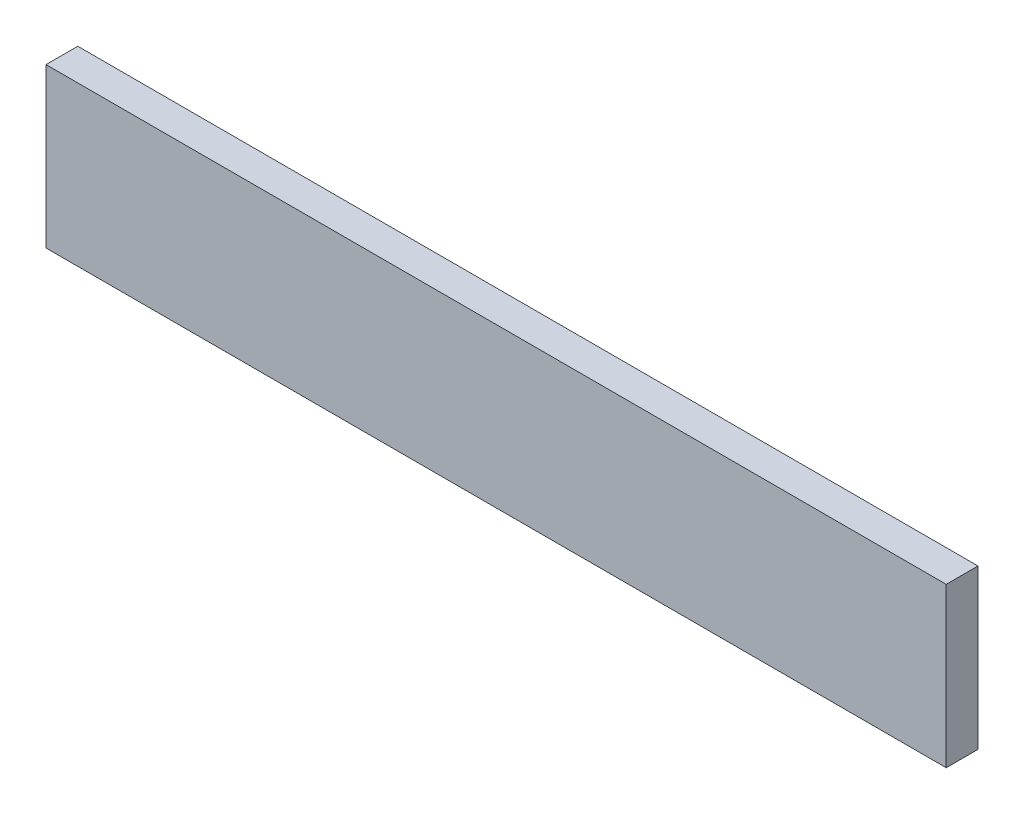
from build123d import *

# Parameters (mm, degrees)
SKETCH1_6_W         = 510
SKETCH1_6_H         = 90
BOSS_EXTRUDE4_DEPTH = 9


with BuildPart() as part:
    # Sketch1<6> → Boss-Extrude4 (new, symmetric)
    with BuildSketch(Plane.XY):
        with Locations((0, 5)):
            Rectangle(SKETCH1_6_W, SKETCH1_6_H)
    extrude(amount=BOSS_EXTRUDE4_DEPTH, both=True)


solid = part.part
